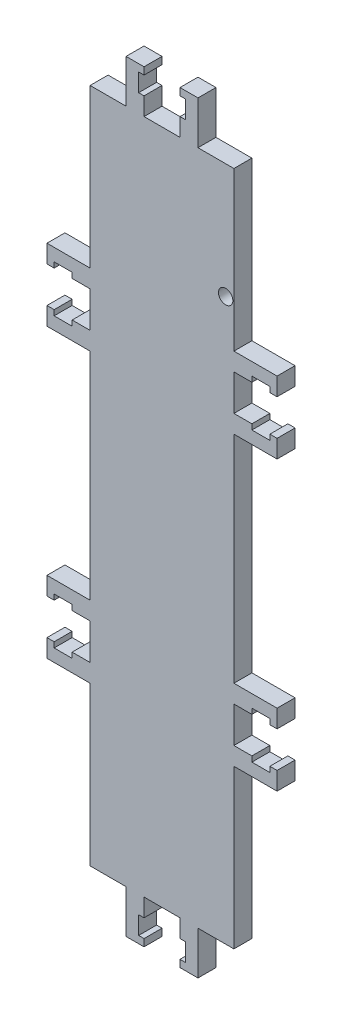
from build123d import *

# Parameters (mm, degrees)
ESQUISSE1_R        = 2
BOSS_EXTRU_1_DEPTH = 5


with BuildPart() as part:
    # Esquisse1 → Boss.-Extru.1 (new body)
    with BuildSketch(Plane.XY):
        Polygon((-10, 193), (-10, 188), (-20, 188), (-20, 144), (-25, 144), (-32, 144), (-32, 139), (-30, 139), (-30, 140.5), (-25, 140.5), (-25, 139), (-20, 139), (-20, 134), (-20, 129), (-25, 129), (-25, 127.5), (-30, 127.5), (-30, 129), (-32, 129), (-32, 124), (-25, 124), (-20, 124), (-20, 64), (-25, 64), (-32, 64), (-32, 59), (-30, 59), (-30, 60.5), (-25, 60.5), (-25, 59), (-20, 59), (-20, 54), (-20, 49), (-25, 49), (-25, 47.5), (-30, 47.5), (-30, 49), (-32, 49), (-32, 44), (-25, 44), (-20, 44), (-20, 0), (-10, 0), (-10, -5), (-10, -12), (-5, -12), (-5, -10), (-6.5, -10), (-6.5, -5), (-5, -5), (-5, 0), (0, 0), (5, 0), (5, -5), (6.5, -5), (6.5, -10), (5, -10), (5, -12), (10, -12), (10, -5), (10, 0), (20, 0), (20, 44), (25, 44), (32, 44), (32, 49), (30, 49), (30, 47.5), (25, 47.5), (25, 49), (20, 49), (20, 54), (20, 59), (25, 59), (25, 60.5), (30, 60.5), (30, 59), (32, 59), (32, 64), (25, 64), (20, 64), (20, 124), (25, 124), (32, 124), (32, 129), (30, 129), (30, 127.5), (25, 127.5), (25, 129), (20, 129), (20, 134), (20, 139), (25, 139), (25, 140.5), (30, 140.5), (30, 139), (32, 139), (32, 144), (25, 144), (20, 144), (20, 188), (10, 188), (10, 193), (10, 200), (5, 200), (5, 198), (6.5, 198), (6.5, 193), (5, 193), (5, 188), (0, 188), (-5, 188), (-5, 193), (-6.5, 193), (-6.5, 198), (-5, 198), (-5, 200), (-10, 200), align=None)
        with Locations((17.7, 156)):
            Circle(ESQUISSE1_R, mode=Mode.SUBTRACT)
    extrude(amount=BOSS_EXTRU_1_DEPTH)


solid = part.part
